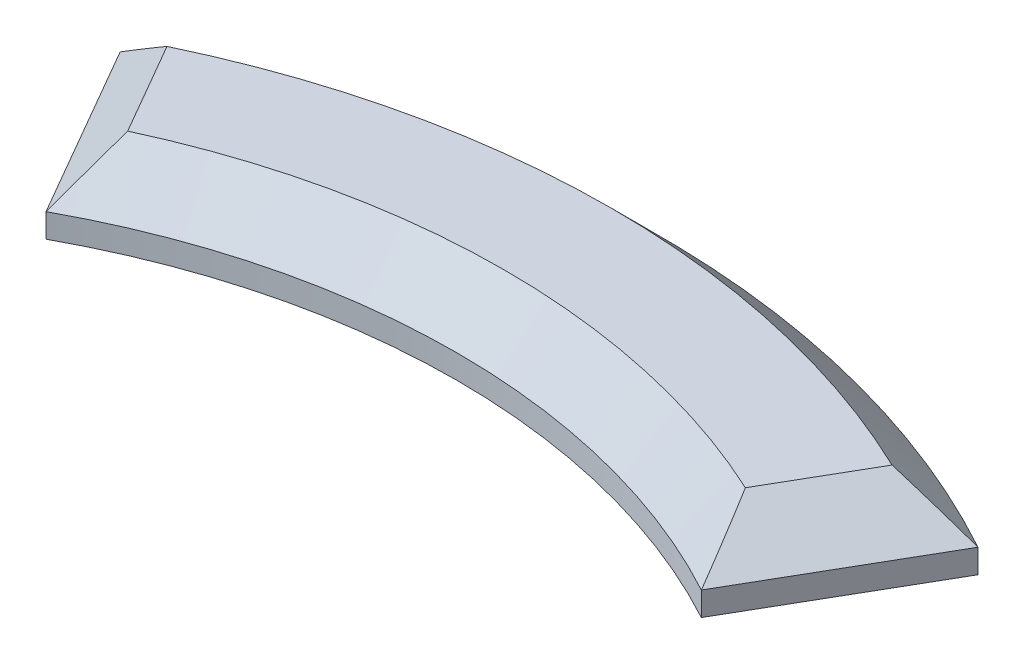
from build123d import *

# Parameters (mm, degrees)
BOSS_EXTRUDE1_DEPTH = 3
CHAMFER1_SIZE       = 2
SKETCH2_R           = 1.625
CUT_EXTRUDE1_DEPTH  = 2


with BuildPart() as part:
    # Sketch1 → Boss-Extrude1 (new body)
    with BuildSketch(Plane(origin=(0, 0, 0), x_dir=(1, 0, 0), z_dir=(0, 1, 0))):
        with BuildLine():
            Line((-17.971705397, 32.627906846), (-13.729256498, 25.279769804))
            ThreePointArc((-13.729256498, 25.279769804), (0, 28.767329478), (13.729256498, 25.279769804))
            Line((13.729256498, 25.279769804), (17.971705397, 32.627906846))
            ThreePointArc((17.971705397, 32.627906846), (0, 37.25), (-17.971705397, 32.627906846))
        make_face()
    extrude(amount=BOSS_EXTRUDE1_DEPTH)

    # Chamfer1
    chamfer1_edges = [part.edges().sort_by_distance(p)[0] for p in [
        (15.850480947, 3, -28.953838325),
        (0, 3, -37.25),
        (0, 3, -28.767329478),
        (-15.850480947, 3, -28.953838325),
    ]]
    chamfer(chamfer1_edges, length=CHAMFER1_SIZE)

    # Sketch2 → Cut-Extrude1 (cut)
    with BuildSketch(Plane.XZ):
        with Locations((0, -33.008664739)):
            Circle(SKETCH2_R)
    extrude(amount=-CUT_EXTRUDE1_DEPTH, mode=Mode.SUBTRACT)


solid = part.part
